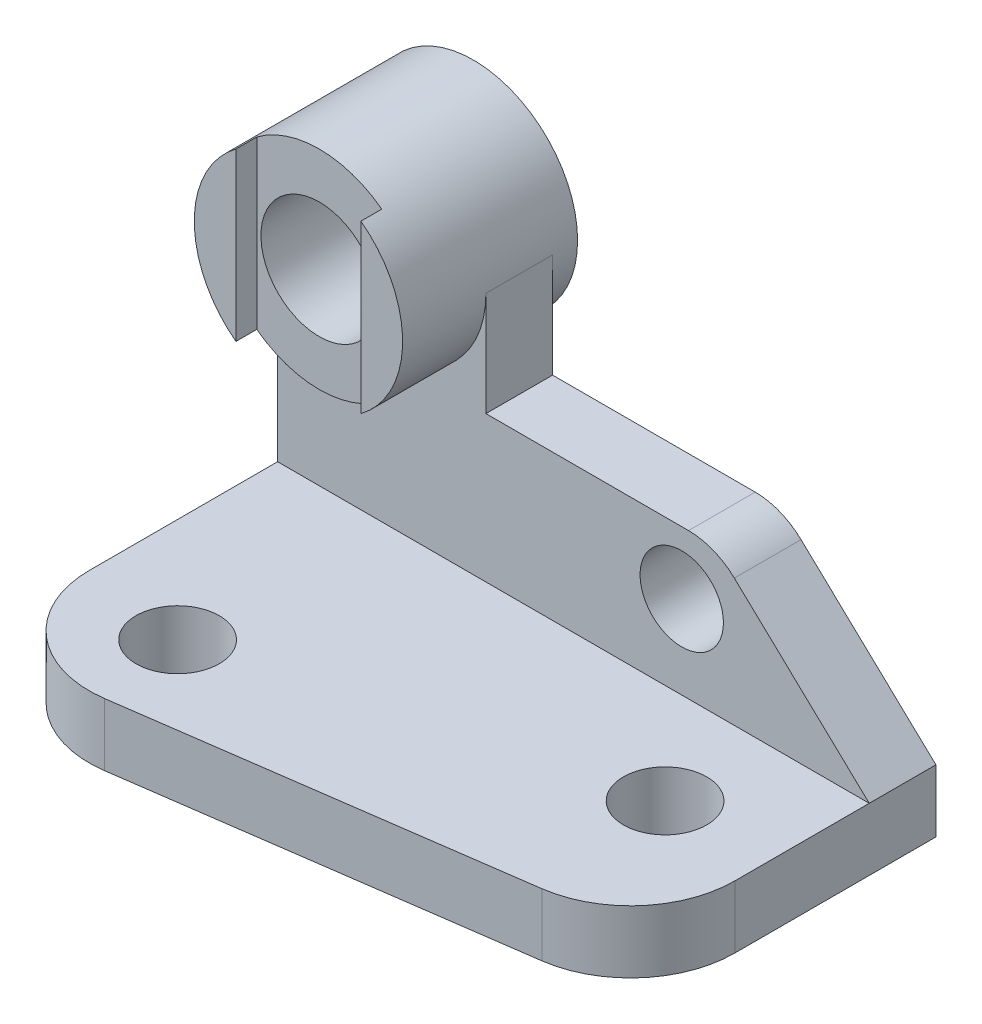
from build123d import *

# Parameters (mm, degrees)
SKETCH1_R               = 10
BOSS_EXTRUDE2_DEPTH     = 15
FILLET3_R               = 25
F_3DSKETCH1_R           = 10
BOSS_EXTRUDE5_DEPTH     = 16
FILLET5_R               = 16
BOSS_EXTRUDE6_START     = -72.295744394
BOSS_EXTRUDE6_OUTLINE_R = 25
BOSS_EXTRUDE6_DEPTH     = 42
SKETCH2_R               = 14
CUT_EXTRUDE1_DEPTH      = 56
CUT_EXTRUDE2_START      = -5
CUT_EXTRUDE2_DEPTH      = 5


# Read off the part's stored shape, not the designer's step: Boss-Extrude6
with BuildPart() as part:
    # Sketch1 → Boss-Extrude2 (new body)
    with BuildSketch(Plane(origin=(0, 0, 0), x_dir=(1, 0, 0), z_dir=(0, 1, 0))):
        Polygon((-60.127867878, 66.295744394), (81.872132122, 66.295744394), (81.872132122, -3.704255606), (-60.127867878, -23.704255606), align=None)
        with Locations(Location((-35.127867878, 1.295744394, 0), (0, 0, 270))):
            Circle(SKETCH1_R, mode=Mode.SUBTRACT)
        with Locations(Location((56.872132122, 26.295744394, 0), (0, 0, 270))):
            Circle(SKETCH1_R, mode=Mode.SUBTRACT)
    extrude(amount=BOSS_EXTRUDE2_DEPTH)

    # Fillet3
    fillet3_edges = [part.edges().sort_by_distance(p)[0] for p in [
        (81.872132122, 7.5, 3.704255606),
        (-60.127867878, 7.5, 23.704255606),
    ]]
    fillet(fillet3_edges, radius=FILLET3_R)

    # 3DSketch1 → Boss-Extrude5 (add)
    with BuildSketch(Plane(origin=(-60.127867878, 15, -66.295744394), x_dir=(1, 0, 0), z_dir=(0, 0, 1))):
        Polygon((0, 0), (142, 0), (105, 35), (50, 35), (50, 60), (0, 60), align=None)
        with Locations((97, 20)):
            Circle(F_3DSKETCH1_R, mode=Mode.SUBTRACT)
    extrude(amount=BOSS_EXTRUDE5_DEPTH)

    # Fillet5
    fillet5_edges = [part.edges().sort_by_distance(p)[0] for p in [
        (44.872132122, 50, -58.295744394),
    ]]
    fillet(fillet5_edges, radius=FILLET5_R)

    # Boss-Extrude6 outline → Boss-Extrude6 (add)
    with BuildSketch(Plane.XY.offset(BOSS_EXTRUDE6_START)):
        with Locations((-35.127867878, 75)):
            Circle(BOSS_EXTRUDE6_OUTLINE_R)
    extrude(amount=BOSS_EXTRUDE6_DEPTH)

    # Sketch2 → Cut-Extrude1 (cut)
    with BuildSketch(Plane.XY.offset(-30.295744394)):
        with Locations((-35.127867878, 75)):
            Circle(SKETCH2_R)
    extrude(amount=-CUT_EXTRUDE1_DEPTH, mode=Mode.SUBTRACT)

    # 3DSketch3 → Cut-Extrude2 (cut)
    with BuildSketch(Plane(origin=(-20.127867878, 95, -30.295744394), x_dir=(-0.5999999999999998, -0.8000000000000002, 0), z_dir=(0, 0, 1)).offset(CUT_EXTRUDE2_START)):
        with BuildLine():
            Line((0, 0), (32, 24))
            ThreePointArc((32, 24), (45, 15), (50, 0))
            Line((50, 0), (18, -24))
            ThreePointArc((18, -24), (5, -15), (0, 0))
        make_face()
    extrude(amount=CUT_EXTRUDE2_DEPTH, mode=Mode.SUBTRACT)


solid = part.part
